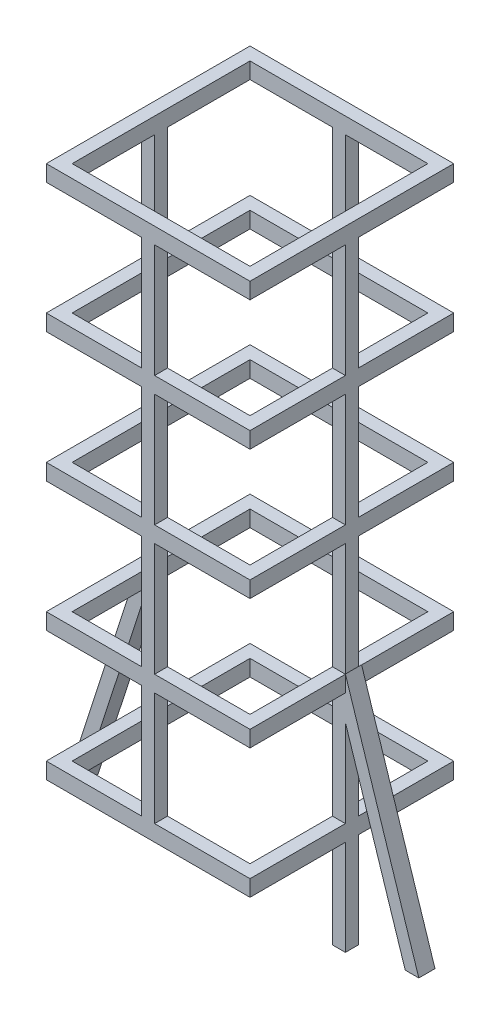
from build123d import *

# Parameters (mm, degrees)
SKETCH_1_W               = 105
SKETCH_1_H               = 105
EXTRUDE_1_DEPTH          = 9
SKETCH_2_R               = 5.5
CUT_EXTRUDE_1_DEPTH      = 9
SKETCH_4_W               = 10
SKETCH_4_H               = 10
EXTRUDE_2_DEPTH          = 30
SKETCH_5_R               = 12.5
EXTRUDE_3_DEPTH          = 10
SKETCH_6_W               = 8
SKETCH_6_H               = 8
EXTRUDE_4_DEPTH          = 380
EXTRUDE_5_DEPTH          = 10
PATTERN_LINEAR_1_COUNT   = 5
PATTERN_LINEAR_1_PITCH   = 80
EXTRUDE_6_DEPTH          = 10
SKETCH_9_W               = 105
SKETCH_9_H               = 15
CUT_EXTRUDE_2_DEPTH      = 59
SPLIT_START              = -31.043560763
SPLIT_BODIES_2_OUTLINE_R = 5.5
SPLIT_BODIES_2_DEPTH     = 40.043560763
SKETCH_10_W              = 8
SKETCH_10_H              = 8
EXTRUDE_8_DEPTH          = 9


# Read off the part's stored shape, not the designer's step: 分割2
with BuildPart() as part:
    # 草图1 → 凸台-拉伸1 (new body)
    with BuildSketch(Plane(origin=(0, 0, 0), x_dir=(1, 0, 0), z_dir=(0, 1, 0))):
        with BuildLine():
            Line((-102.5, 102.5), (102.5, 102.5))
            Line((102.5, 102.5), (146.930137945, 8.550357413))
            ThreePointArc((146.930137945, 8.550357413), (148.85, 0), (146.930137945, -8.550357413))
            Line((146.930137945, -8.550357413), (90, -67.5))
            Line((90, -67.5), (52.5, -67.5))
            Line((52.5, -67.5), (-52.5, -67.5))
            Line((-52.5, -67.5), (-90, -67.5))
            Line((-90, -67.5), (-146.930137945, -8.550357413))
            ThreePointArc((-146.930137945, -8.550357413), (-148.85, 0), (-146.930137945, 8.550357413))
            Line((-146.930137945, 8.550357413), (-102.5, 102.5))
        make_face()
        Rectangle(SKETCH_1_W, SKETCH_1_H, mode=Mode.SUBTRACT)
    extrude(amount=EXTRUDE_1_DEPTH)

    # 草图2 → 切除-拉伸1 (cut)
    with BuildSketch(Plane(origin=(0, 9, 0), x_dir=(1, 0, 0), z_dir=(0, 1, 0))):
        with Locations(Location((-128.85, 0, 0), (0, 0, 270))):
            Circle(SKETCH_2_R)
        with Locations(Location((128.85, 0, 0), (0, 0, 270))):
            Circle(SKETCH_2_R)
    extrude(amount=-CUT_EXTRUDE_1_DEPTH, mode=Mode.SUBTRACT)

    # 草图4 → 凸台-拉伸2 (add)
    with BuildSketch(Plane.XZ):
        with Locations((-92, 0)):
            Rectangle(SKETCH_4_W, SKETCH_4_H)
        with Locations((92, 0)):
            Rectangle(SKETCH_4_W, SKETCH_4_H)
    extrude(amount=EXTRUDE_2_DEPTH)

    # 草图5 → 凸台-拉伸3 (add)
    with BuildSketch(Plane.ZY.offset(-87)):
        with Locations((0, -18.543560763)):
            Circle(SKETCH_5_R)
    extrude_3 = extrude(amount=-EXTRUDE_3_DEPTH)

    # 镜向1: 凸台-拉伸3 across plane
    add(extrude_3.mirror(Plane(origin=(0, 0, 0), x_dir=(0, 0, 1), z_dir=(1, 0, 0))))

    # 草图6 → 凸台-拉伸4 (add)
    with BuildSketch(Plane(origin=(0, 9, 0), x_dir=(1, 0, 0), z_dir=(0, 1, 0))):
        with Locations((-59, 0)):
            Rectangle(SKETCH_6_W, SKETCH_6_H)
        with Locations((59, 0)):
            Rectangle(SKETCH_6_W, SKETCH_6_H)
        with Locations((0, 59)):
            Rectangle(SKETCH_6_W, SKETCH_6_H)
        with Locations((0, -59)):
            Rectangle(SKETCH_6_W, SKETCH_6_H)
    extrude(amount=EXTRUDE_4_DEPTH)

    # 草图7 → 凸台-拉伸5 (add)
    with BuildSketch(Plane(origin=(0, 389, 0), x_dir=(1, 0, 0), z_dir=(0, 1, 0))):
        Polygon((-63, 4), (-63, 63), (63, 63), (63, -63), (-63, -63), align=None)
        Polygon((-55, 4), (-55, 55), (55, 55), (55, -55), (-55, -55), align=None, mode=Mode.SUBTRACT)
    extrude_5 = extrude(amount=-EXTRUDE_5_DEPTH)

    # 阵列(线性)1: 凸台-拉伸5 ×5
    with Locations(*[(0, -i * PATTERN_LINEAR_1_PITCH, 0) for i in range(1, PATTERN_LINEAR_1_COUNT)]):
        add(extrude_5)

    # 草图8 → 凸台-拉伸6 (add)
    with BuildSketch(Plane.XY.offset(4)):
        Polygon((-100, 9), (-63, 123.153405556), (-63, 149.099351502), (-108.409735963, 9), align=None)
        Polygon((108.409735963, 9), (100, 9), (63, 123.153405556), (63, 149.099351502), align=None)
    extrude(amount=-EXTRUDE_6_DEPTH)

    # 草图9 → 切除-拉伸2 (cut)
    with BuildSketch(Plane.XZ):
        with Locations((0, 60)):
            Rectangle(SKETCH_9_W, SKETCH_9_H)
    extrude(amount=-CUT_EXTRUDE_2_DEPTH, mode=Mode.SUBTRACT)

    # Split Bodies 2 outline → Split Bodies 2 (cut)
    with BuildSketch(Plane(origin=(0, 0, 0), x_dir=(1, 0, 0), z_dir=(0, 1, 0)).offset(SPLIT_START)):
        with BuildLine():
            Line((-90, -67.5), (-52.5, -67.5))
            Line((-52.5, -67.5), (-52.5, 52.5))
            Line((-52.5, 52.5), (52.5, 52.5))
            Line((52.5, 52.5), (52.5, -67.5))
            Line((52.5, -67.5), (90, -67.5))
            Line((90, -67.5), (146.930137945, -8.550357413))
            ThreePointArc((146.930137945, -8.550357413), (148.85, 0), (146.930137945, 8.550357413))
            Line((146.930137945, 8.550357413), (102.5, 102.5))
            Line((102.5, 102.5), (-102.5, 102.5))
            Line((-102.5, 102.5), (-146.930137945, 8.550357413))
            ThreePointArc((-146.930137945, 8.550357413), (-148.85, 0), (-146.930137945, -8.550357413))
            Line((-146.930137945, -8.550357413), (-90, -67.5))
        make_face()
        with Locations((-128.85, 0)):
            Circle(SPLIT_BODIES_2_OUTLINE_R, mode=Mode.SUBTRACT)
        with Locations((128.85, 0)):
            Circle(SPLIT_BODIES_2_OUTLINE_R, mode=Mode.SUBTRACT)
    extrude(amount=SPLIT_BODIES_2_DEPTH, mode=Mode.SUBTRACT)

    # 草图10 → 凸台-拉伸8 (add)
    with BuildSketch(Plane.XZ.offset(-9)):
        with Locations((-59, 0)):
            Rectangle(SKETCH_10_W, SKETCH_10_H)
        with Locations((59, 0)):
            Rectangle(SKETCH_10_W, SKETCH_10_H)
    extrude(amount=EXTRUDE_8_DEPTH)


solid = part.part
